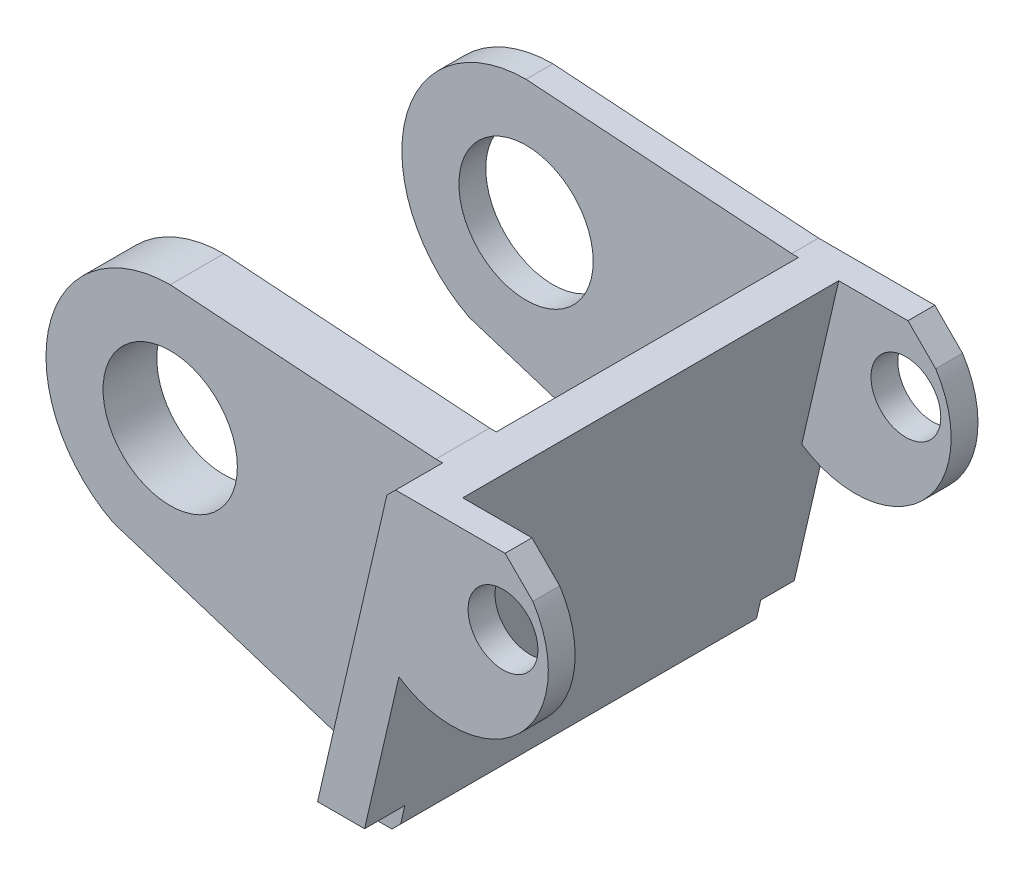
from build123d import *
from OCP.BRepFilletAPI import BRepFilletAPI_MakeChamfer

# Parameters (mm, degrees)
BOSS_EXTRU_1_DEPTH      = 320
ENL_V_MAT_EXTRU_1_DEPTH = 30
ENL_V_START             = -295
ENL_V_MAT_EXTRU_2_DEPTH = 25
ESQUISSE5_R             = 26
BOSS_EXTRU_2_DEPTH      = 20
BOSS_EXTRU_3_START      = -35
ESQUISSE5_3_R           = 50
BOSS_EXTRU_3_DEPTH      = 40
BOSS_EXTRU_4_START      = -300
ESQUISSE5_5_R           = 50
BOSS_EXTRU_4_DEPTH      = 20
BOSS_EXTRU_5_START      = -300
ESQUISSE5_6_R           = 26
BOSS_EXTRU_5_DEPTH      = 20
CHANFREIN1_SIZE         = 5
CHANFREIN1_SIZE_2       = 6.671835022
CHANFREIN2_SIZE         = 5
CHANFREIN2_SIZE2        = 6.671835022
CHANFREIN2_SIZE2_2      = 4.169025226
CHANFREIN5_START        = 181.632019665
CHANFREIN5_OUTLINE_W    = 32
CHANFREIN5_OUTLINE_H    = 22
CHANFREIN5_DEPTH        = 2.367980335
CHANFREIN6_START        = 181.632019665
CHANFREIN6_OUTLINE_W    = 32
CHANFREIN6_OUTLINE_H    = 22
CHANFREIN6_DEPTH        = 2.367980335


with BuildPart() as part:
    # Esquisse1 → Boss.-Extru.1 (new body)
    with BuildSketch(Plane.XY):
        Polygon((10.109909982, 160.217391304), (45.109909982, 160.217391304), (-12.607137799, -89.782608696), (-47.607137799, -89.782608696), align=None)
    extrude(amount=BOSS_EXTRU_1_DEPTH)

    # Esquisse2 → Enlèv. mat.-Extru.1 (cut)
    with BuildSketch(Plane.XY.offset(320)):
        Polygon((-47.607137799, -89.782608696), (-42.989773977, -69.782608696), (-7.989773977, -69.782608696), (-12.607137799, -89.782608696), align=None)
    extrude(amount=-ENL_V_MAT_EXTRU_1_DEPTH, mode=Mode.SUBTRACT)

    # Esquisse3 → Enlèv. mat.-Extru.2 (cut)
    with BuildSketch(Plane.XY.offset(320).offset(ENL_V_START)):
        Polygon((-47.607137799, -89.782608696), (-42.989773977, -69.782608696), (-7.989773977, -69.782608696), (-12.607137799, -89.782608696), align=None)
    extrude(amount=-ENL_V_MAT_EXTRU_2_DEPTH, mode=Mode.SUBTRACT)

    # Esquisse5 → Boss.-Extru.2 (add)
    with BuildSketch(Plane.XY.offset(320)):
        with BuildLine():
            Line((96.899074267, 160.217391304), (45.109909982, 160.217391304))
            Line((45.109909982, 160.217391304), (17.591978342, 41.024134293))
            ThreePointArc((17.591978342, 41.024134293), (116.84215481, 60.967214836), (96.899074267, 160.217391304))
        make_face()
        with Locations((95.109909982, 110.217391304)):
            Circle(ESQUISSE5_R, mode=Mode.SUBTRACT)
    extrude(amount=-BOSS_EXTRU_2_DEPTH)

    # Esquisse5<3> → Boss.-Extru.3 (add)
    with BuildSketch(Plane.XY.offset(320).offset(BOSS_EXTRU_3_START)):
        with BuildLine():
            Line((-230.213971145, -0.950262244), (-40.985726083, -61.102123595))
            Line((-40.985726083, -61.102123595), (10.109909982, 160.217391304))
            Line((10.109909982, 160.217391304), (-187.731895981, 173.717391304))
            ThreePointArc((-187.731895981, 173.717391304), (-277.611698921, 103.077652588), (-230.213971145, -0.950262244))
        make_face()
        with Locations((-187.731895981, 81.217391304)):
            Circle(ESQUISSE5_3_R, mode=Mode.SUBTRACT)
    extrude(amount=-BOSS_EXTRU_3_DEPTH)

    # Esquisse5<5> → Boss.-Extru.4 (add)
    with BuildSketch(Plane.XY.offset(320).offset(BOSS_EXTRU_4_START)):
        with BuildLine():
            Line((-230.213971145, -0.950262244), (-40.985726083, -61.102123595))
            Line((-40.985726083, -61.102123595), (10.109909982, 160.217391304))
            Line((10.109909982, 160.217391304), (-187.731895981, 173.717391304))
            ThreePointArc((-187.731895981, 173.717391304), (-277.611698921, 103.077652588), (-230.213971145, -0.950262244))
        make_face()
        with Locations((-187.731895981, 81.217391304)):
            Circle(ESQUISSE5_5_R, mode=Mode.SUBTRACT)
    extrude(amount=-BOSS_EXTRU_4_DEPTH)

    # Esquisse5<6> → Boss.-Extru.5 (add)
    with BuildSketch(Plane.XY.offset(320).offset(BOSS_EXTRU_5_START)):
        with BuildLine():
            Line((96.899074267, 160.217391304), (45.109909982, 160.217391304))
            Line((45.109909982, 160.217391304), (17.591978342, 41.024134293))
            ThreePointArc((17.591978342, 41.024134293), (116.84215481, 60.967214836), (96.899074267, 160.217391304))
        make_face()
        with Locations((95.109909982, 110.217391304)):
            Circle(ESQUISSE5_6_R, mode=Mode.SUBTRACT)
    extrude(amount=-BOSS_EXTRU_5_DEPTH)

    # Chanfrein1
    # the kernel refuses this chamfer: 6.671835022, 5 mm, written as the material it takes off along each edge
    with BuildSketch(Plane(origin=(10.109909982, 160.217391304, 20), x_dir=(1, 0, 0), z_dir=(0, 0, 1))) as chanfrein1_piece_1:
        Polygon((CHANFREIN1_SIZE, 0), (-CHANFREIN1_SIZE_2 * 0.224951054343, -CHANFREIN1_SIZE_2 * 0.974370064782), (0, 0), align=None)
    extrude(amount=225, mode=Mode.SUBTRACT)
    with BuildSketch(Plane(origin=(10.109909982, 160.217391304, 285), x_dir=(1, 0, 0), z_dir=(0, 0, 1))) as chanfrein1_piece_2:
        Polygon((CHANFREIN1_SIZE, 0), (-CHANFREIN1_SIZE_2 * 0.224951054343, -CHANFREIN1_SIZE_2 * 0.974370064782), (0, 0), align=None)
    extrude(amount=52.24901503, mode=Mode.SUBTRACT)

    # Chanfrein2: one chamfer whose edges measure the first distance from different faces: ONE call of the kernel's chamfer builder (chamfer() names one face for all edges)
    chanfrein2_edges_1 = [part.edges().sort_by_distance(p)[0] for p in [
        (-12.607137799, -89.782608696, 157.5),
    ]]
    chanfrein2_side_1 = [part.faces().sort_by_distance(p)[0] for p in [
        (-30.107137799, -89.782608696, 157.5),
    ]]
    chanfrein2_edges_2 = [part.edges().sort_by_distance(p)[0] for p in [
        (-47.607137799, -89.782608696, 157.5),
    ]]
    chanfrein2_side_2 = [part.faces().sort_by_distance(p)[0] for p in [
        (-19.722598228, 30.998601722, 155.760522115),
    ]]
    chanfrein2 = BRepFilletAPI_MakeChamfer(part.part.solid().wrapped)
    for e in chanfrein2_edges_1:
        chanfrein2.Add(CHANFREIN2_SIZE, CHANFREIN2_SIZE2, e.wrapped, chanfrein2_side_1[0].wrapped)  # the first distance lies on this face
    for e in chanfrein2_edges_2:
        chanfrein2.Add(CHANFREIN2_SIZE, CHANFREIN2_SIZE2_2, e.wrapped, chanfrein2_side_2[0].wrapped)  # the first distance lies on this face
    add(Compound.cast(chanfrein2.Shape()), mode=Mode.REPLACE)

    # Chanfrein5: read off the stored shape, not the designer's step
    # Chanfrein5 outline → Chanfrein5 (cut)
    with BuildSketch(Plane(origin=(0, 0, 0), x_dir=(0.7071067811865471, -0.707106781186548, 0), z_dir=(0.707106781186548, 0.707106781186547, 0)).offset(CHANFREIN5_START)):
        with Locations((-30, -310)):
            Rectangle(CHANFREIN5_OUTLINE_W, CHANFREIN5_OUTLINE_H)
    extrude(amount=CHANFREIN5_DEPTH, mode=Mode.SUBTRACT)

    # Chanfrein6: read off the stored shape, not the designer's step
    # Chanfrein6 outline → Chanfrein6 (cut)
    with BuildSketch(Plane(origin=(0, 0, 0), x_dir=(0.707106781186546, -0.707106781186549, 0), z_dir=(0.707106781186549, 0.707106781186546, 0)).offset(CHANFREIN6_START)):
        with Locations((-30, -10)):
            Rectangle(CHANFREIN6_OUTLINE_W, CHANFREIN6_OUTLINE_H)
    extrude(amount=CHANFREIN6_DEPTH, mode=Mode.SUBTRACT)


solid = part.part
